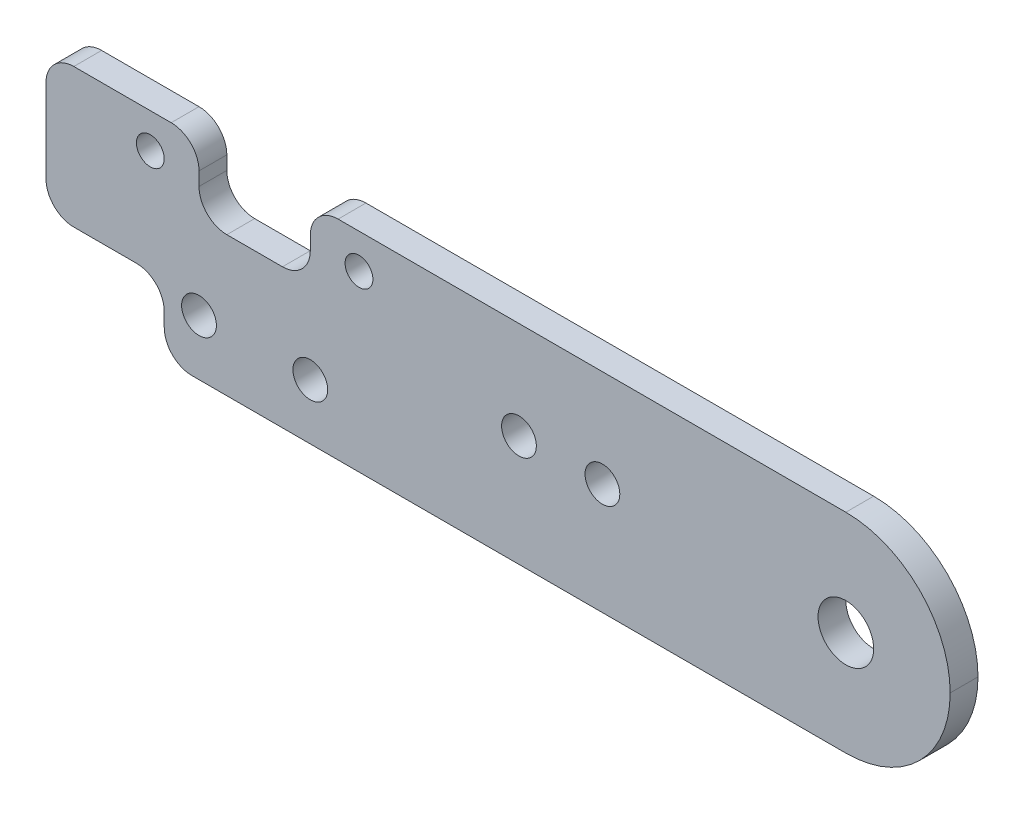
from build123d import *

# Parameters (mm, degrees)
SKETCH_1_W          = 65
SKETCH_1_H          = 15
EXTRUDE_1_DEPTH     = 2
FILLET_1_R          = 7.5
SKETCH_2_R          = 2
SKETCH_2_R_2        = 1
CUT_EXTRUDE_1_DEPTH = 10
SKETCH_4_R          = 1.25
CUT_EXTRUDE_3_DEPTH = 10
SKETCH_8_R          = 1.25
CUT_EXTRUDE_6_DEPTH = 10
SKETCH_9_W          = 8
SKETCH_9_H          = 4.970258762
CUT_EXTRUDE_7_DEPTH = 10
SKETCH_10_W         = 8.5
SKETCH_10_H         = 5
CUT_EXTRUDE_8_DEPTH = 2
FILLET_3_R          = 2


with BuildPart() as part:
    # 草图1 → 凸台-拉伸1 (new body)
    with BuildSketch(Plane.XY):
        Rectangle(SKETCH_1_W, SKETCH_1_H)
    extrude(amount=EXTRUDE_1_DEPTH)

    # 圆角1
    fillet_1_edges = [part.edges().sort_by_distance(p)[0] for p in [
        (32.5, 7.5, 1),
        (32.5, -7.5, 1),
    ]]
    fillet(fillet_1_edges, radius=FILLET_1_R - 0.0001)  # a hair under: the kernel refuses the full size

    # 草图2 → 切除-拉伸1 (cut)
    with BuildSketch(Plane.XY.offset(2)):
        with Locations((25, 0)):
            Circle(SKETCH_2_R)
        with Locations((-25, 5)):
            Circle(SKETCH_2_R_2)
        with Locations((-10, 5)):
            Circle(SKETCH_2_R_2)
    extrude(amount=-CUT_EXTRUDE_1_DEPTH, mode=Mode.SUBTRACT)

    # 草图4 → 切除-拉伸3 (cut)
    with BuildSketch(Plane(origin=(0, 0, 0), x_dir=(-1, 0, 0), z_dir=(0, 0, -1))):
        with Locations((21.5, -3.5)):
            Circle(SKETCH_4_R)
        with Locations((13.5, -3.5)):
            Circle(SKETCH_4_R)
    extrude(amount=-CUT_EXTRUDE_3_DEPTH, mode=Mode.SUBTRACT)

    # 草图8 → 切除-拉伸6 (cut)
    with BuildSketch(Plane.XY.offset(2)):
        with Locations((7.5, 0.5)):
            Circle(SKETCH_8_R)
        with Locations((1.5, 0.5)):
            Circle(SKETCH_8_R)
    extrude(amount=-CUT_EXTRUDE_6_DEPTH, mode=Mode.SUBTRACT)

    # 草图9 → 切除-拉伸7 (cut)
    with BuildSketch(Plane.XY.offset(2)):
        with Locations((-17.5, 5.014870619)):
            Rectangle(SKETCH_9_W, SKETCH_9_H)
    extrude(amount=-CUT_EXTRUDE_7_DEPTH, mode=Mode.SUBTRACT)

    # 草图10 → 切除-拉伸8 (cut)
    with BuildSketch(Plane.XY.offset(2)):
        with Locations((-28.25, -5)):
            Rectangle(SKETCH_10_W, SKETCH_10_H)
    extrude(amount=-CUT_EXTRUDE_8_DEPTH, mode=Mode.SUBTRACT)

    # 圆角3
    fillet_3_edges = [part.edges().sort_by_distance(p)[0] for p in [
        (-21.5, 2.529741238, 1),
        (-21.5, 7.5, 1),
        (-13.5, 7.5, 1),
        (-13.5, 2.529741238, 1),
        (-32.5, 7.5, 1),
        (-32.5, -2.5, 1),
        (-24, -2.5, 1),
        (-24, -7.5, 1),
    ]]
    fillet(fillet_3_edges, radius=FILLET_3_R)


solid = part.part
